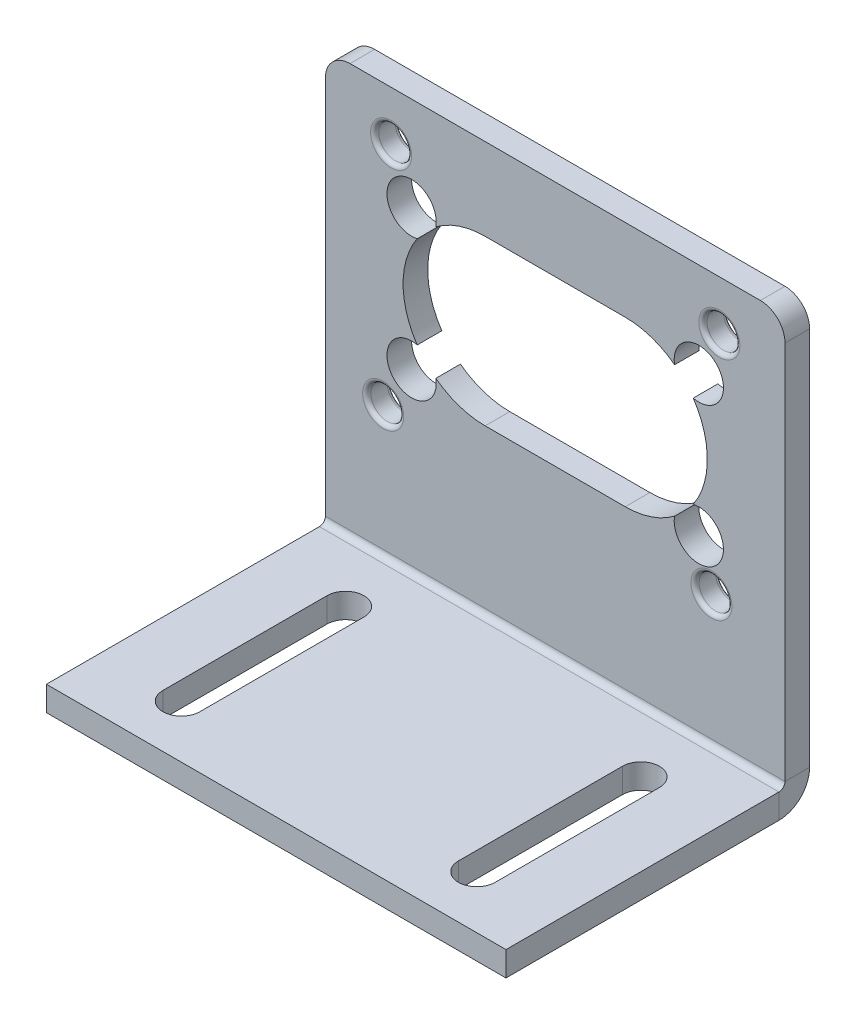
from build123d import *

# Parameters (mm, degrees)
SKETCH_2_R                       = 2
SM_BASE_FLANGE_1_DEPTH           = 3
FILLET_4_R                       = 0.5
SM_EDGE_FLANGE_2_STRIP_W         = 13.4732
SM_EDGE_FLANGE_2_STRIP_H         = 3
SM_EDGE_FLANGE_2_STRIP_CUT_DEPTH = 56
SM_EDGE_FLANGE_2_DEPTH           = 56
CUT_EXTRUDE_1_DEPTH              = 69.912988616


# Sheet-metal steps are written as plain solids
with BuildPart() as part:
    # Sketch 2 → 基体-法兰1 (new body)
    with BuildSketch(Plane.XY):
        with BuildLine():
            Line((25, -25), (-25, -25))
            Line((-25, -25), (-28, -25))
            Line((-28, -25), (-28, -22))
            Line((-28, -22), (-28, 22))
            ThreePointArc((-28, 22), (-27.121320344, 24.121320344), (-25, 25))
            Line((-25, 25), (25, 25))
            ThreePointArc((25, 25), (27.121320344, 24.121320344), (28, 22))
            Line((28, 22), (28, -22))
            Line((28, -22), (28, -25))
            Line((28, -25), (25, -25))
        make_face()
        with Locations((-20, 19)):
            Circle(SKETCH_2_R, mode=Mode.SUBTRACT)
        with Locations(Location((20, 19, 0), (0, 0, 180))):
            Circle(SKETCH_2_R, mode=Mode.SUBTRACT)
        with Locations((-20.965924131, -9)):
            Circle(SKETCH_2_R, mode=Mode.SUBTRACT)
        with Locations((19.034075869, -9)):
            Circle(SKETCH_2_R, mode=Mode.SUBTRACT)
        with BuildLine():
            Line((-8.534422744, 15), (8.534422744, 15))
            ThreePointArc((8.534422744, 15), (11.704939866, 14.484082517), (14.548311944, 12.989564236))
            ThreePointArc((14.548311944, 12.989564236), (19.673969914, 15.593119942), (16.816116637, 10.604778877))
            ThreePointArc((16.816116637, 10.604778877), (18.534422744, 5), (16.816116637, -0.604778877))
            ThreePointArc((16.816116637, -0.604778877), (19.673969914, -5.593119942), (14.548311944, -2.989564236))
            ThreePointArc((14.548311944, -2.989564236), (11.704939866, -4.484082517), (8.534422744, -5))
            Line((8.534422744, -5), (-8.534422744, -5))
            ThreePointArc((-8.534422744, -5), (-11.704939866, -4.484082517), (-14.548311944, -2.989564236))
            ThreePointArc((-14.548311944, -2.989564236), (-19.673969914, -5.593119942), (-16.816116637, -0.604778877))
            ThreePointArc((-16.816116637, -0.604778877), (-18.534422744, 5), (-16.816116637, 10.604778877))
            ThreePointArc((-16.816116637, 10.604778877), (-19.673969914, 15.593119942), (-14.548311944, 12.989564236))
            ThreePointArc((-14.548311944, 12.989564236), (-11.704939866, 14.484082517), (-8.534422744, 15))
        make_face(mode=Mode.SUBTRACT)
    extrude(amount=-SM_BASE_FLANGE_1_DEPTH)

    # 圆角4
    fillet_4_edges = [part.edges().sort_by_distance(p)[0] for p in [
        (-22, 19, -3),
        (-22, 19, 0),
        (22, 19, -3),
        (22, 19, 0),
        (-22.965924131, -9, -3),
        (-22.965924131, -9, 0),
        (17.034075869, -9, -3),
        (17.034075869, -9, 0),
    ]]
    fillet(fillet_4_edges, radius=FILLET_4_R)

    # 边线-法兰2 strip (across the edge) → 边线-法兰2 strip cut (cut)
    with BuildSketch(Plane(origin=(-28, -25, 0), x_dir=(0, 1, 0), z_dir=(1, 0, 0))):
        with Locations((-6, -1.5)):
            Rectangle(SM_EDGE_FLANGE_2_STRIP_W, SM_EDGE_FLANGE_2_STRIP_H)
    extrude(amount=SM_EDGE_FLANGE_2_STRIP_CUT_DEPTH, mode=Mode.SUBTRACT)

    # 边线-法兰2 section (across the edge) → 边线-法兰2 (add)
    with BuildSketch(Plane(origin=(-28, -25, 0), x_dir=(0, 1, 0), z_dir=(1, 0, 0))):
        with BuildLine():
            Line((-3, 0.7366), (-3, 34))
            Line((-3, 34), (0, 34))
            Line((0, 34), (0, 0.7366))
            ThreePointArc((0, 0.7366), (0.215745145, 0.215745145), (0.7366, 0))
            Line((0.7366, 0), (0.7366, -3))
            ThreePointArc((0.7366, -3), (-1.905575199, -1.905575199), (-3, 0.7366))
        make_face()
    extrude(amount=SM_EDGE_FLANGE_2_DEPTH)

    # 草图6 → 切除-拉伸1 (cut, through all)
    with BuildSketch(Plane.XZ.offset(28)):
        with BuildLine():
            Line((-15.75, 27.551137587), (-15.75, 7.551137587))
            ThreePointArc((-15.75, 7.551137587), (-18, 5.301137587), (-20.25, 7.551137587))
            Line((-20.25, 7.551137587), (-20.25, 27.551137587))
            ThreePointArc((-20.25, 27.551137587), (-18, 29.801137587), (-15.75, 27.551137587))
        make_face()
        with BuildLine():
            Line((20.25, 27.551137587), (20.25, 7.551137587))
            ThreePointArc((20.25, 7.551137587), (18, 5.301137587), (15.75, 7.551137587))
            Line((15.75, 7.551137587), (15.75, 27.551137587))
            ThreePointArc((15.75, 27.551137587), (18, 29.801137587), (20.25, 27.551137587))
        make_face()
    extrude(amount=-CUT_EXTRUDE_1_DEPTH, mode=Mode.SUBTRACT)


solid = part.part
